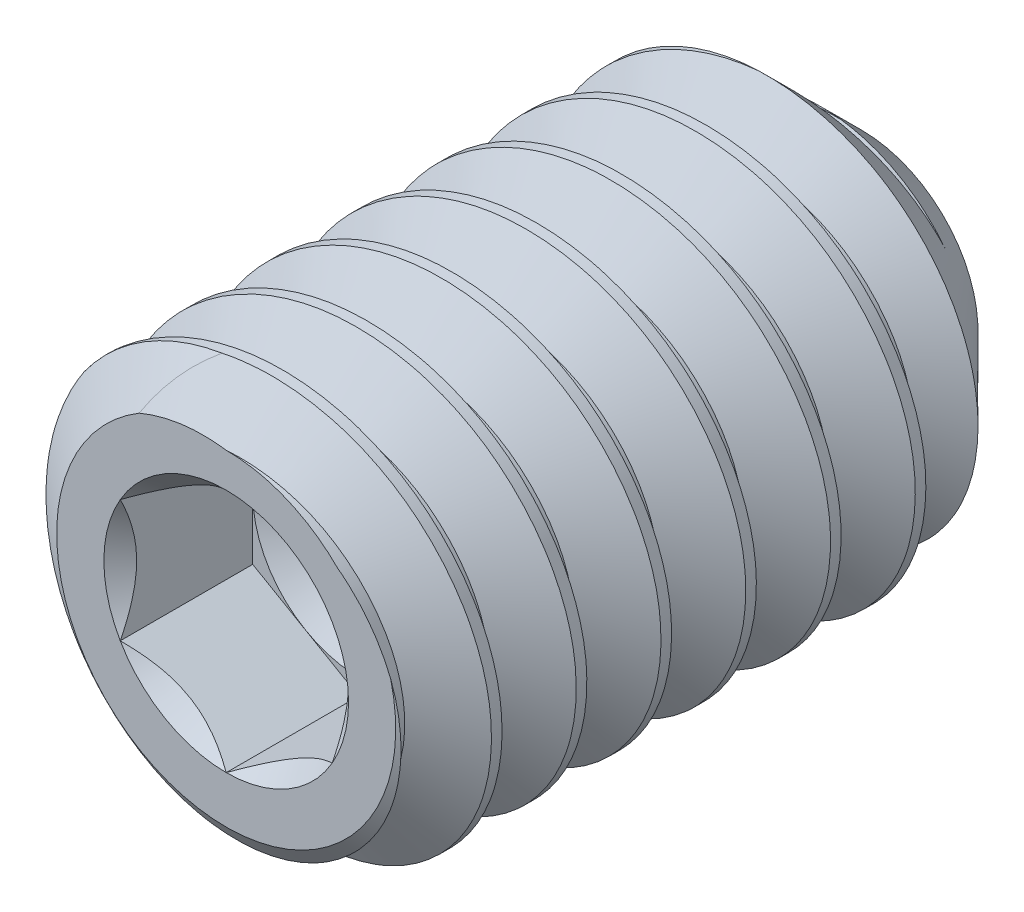
from build123d import *

# Parameters (mm, degrees)
CUT_SWEEP2_PITCH    = 1.27
CUT_EXTRUDE10_DEPTH = 1.984375


with BuildPart() as part:
    # Sketch22 → Revolve1 (revolve)
    with BuildSketch(Plane(origin=(0, 0, 0), x_dir=(0, 0, -1), z_dir=(1, 0, 0)), mode=Mode.PRIVATE) as revolve1_sk:
        Polygon((-4.239814779, 0), (-4.239814779, 2.54), (-3.795182992, 3.175), (3.849973798, 3.175), (5.285185221, 1.739788577), (4.239814779, 0), align=None)
    revolve(revolve1_sk.sketch.rotate(Axis((0, 0, -4.239814779), (0, 0, -1)), 180), axis=Axis((0, 0, -4.239814779), (0, 0, -1)))

    # Cut-Sweep2: the profile of Sketch28 profile screwed along a right-hand helix of 8.5 turns, 8 arcs to a turn; built about Z, then put on its axis
    cut_sweep2_z = Axis((0, 0, 0), (0, 0, 1))
    cut_sweep2_corners = [(3.1753, 0, 0.000173205), (3.1753, 0, -1.111423205), (2.350110803, 0, -0.635), (2.350110803, 0, -0.47625)]
    with BuildLine(mode=Mode.PRIVATE) as cut_sweep2_profile:
        Line(cut_sweep2_corners[0], cut_sweep2_corners[1])
        Line(cut_sweep2_corners[1], cut_sweep2_corners[2])
        Line(cut_sweep2_corners[2], cut_sweep2_corners[3])
        Line(cut_sweep2_corners[3], cut_sweep2_corners[0])
    cut_sweep2_cap = Face(cut_sweep2_profile.wire())
    cut_sweep2_turn_angles = [0, 22.5, 45, 67.5, 90, 112.5, 135, 157.5, 180, 202.5, 225, 247.5, 270, 292.5, 315, 337.5, 360]
    cut_sweep2_turn_weights = [1, 0.9238795325112867, 1, 0.9238795325112867, 1, 0.9238795325112867, 1, 0.9238795325112867, 1, 0.9238795325112867, 1, 0.9238795325112867, 1, 0.9238795325112867, 1, 0.9238795325112867, 1]
    cut_sweep2_turn_rails = [Edge.make_bspline([Vector(p[0], p[1], 0).rotate(cut_sweep2_z, cut_sweep2_turn_angles[k]) / cut_sweep2_turn_weights[k] + Vector(0, 0, p[2] + CUT_SWEEP2_PITCH * cut_sweep2_turn_angles[k] / 360) for k in range(17)], [0, 0, 0, 1, 1, 2, 2, 3, 3, 4, 4, 5, 5, 6, 6, 7, 7, 8, 8, 8], 2, cut_sweep2_turn_weights) for p in cut_sweep2_corners]
    cut_sweep2_turn_sides = [Face.make_surface_from_curves(cut_sweep2_turn_rails[p[0]], cut_sweep2_turn_rails[p[1]]) for p in [(0, 1), (1, 2), (2, 3), (3, 0)]]
    cut_sweep2_last_angles = [2880, 2902.5, 2925, 2947.5, 2970, 2992.5, 3015, 3037.5, 3060]
    cut_sweep2_last_weights = [1, 0.9238795325112867, 1, 0.9238795325112867, 1, 0.9238795325112867, 1, 0.9238795325112867, 1]
    cut_sweep2_last_rails = [Edge.make_bspline([Vector(p[0], p[1], 0).rotate(cut_sweep2_z, cut_sweep2_last_angles[k]) / cut_sweep2_last_weights[k] + Vector(0, 0, p[2] + CUT_SWEEP2_PITCH * cut_sweep2_last_angles[k] / 360) for k in range(9)], [0, 0, 0, 1, 1, 2, 2, 3, 3, 4, 4, 4], 2, cut_sweep2_last_weights) for p in cut_sweep2_corners]
    cut_sweep2_last_sides = [Face.make_surface_from_curves(cut_sweep2_last_rails[p[0]], cut_sweep2_last_rails[p[1]]) for p in [(0, 1), (1, 2), (2, 3), (3, 0)]]
    cut_sweep2 = Plane(origin=(0, 0, -5.285185221), x_dir=(0, 1, 0), z_dir=(0, 0, 1)) * Solid(Shell([*[p.moved(Location((0, 0, CUT_SWEEP2_PITCH * i))) for i in range(8) for p in cut_sweep2_turn_sides], *cut_sweep2_last_sides, cut_sweep2_cap, cut_sweep2_cap.rotate(cut_sweep2_z, 3060).moved(Location((0, 0, CUT_SWEEP2_PITCH * 3060 / 360)))]))
    add(cut_sweep2, mode=Mode.SUBTRACT)

    # Sketch23 → Cut-Extrude10 (cut)
    with BuildSketch(Plane.XY.offset(4.239814779)):
        Polygon((0, 1.833087105), (-1.5875, 0.916543552), (-1.5875, -0.916543552), (0, -1.833087105), (1.5875, -0.916543552), (1.5875, 0.916543552), align=None)
    extrude(amount=-CUT_EXTRUDE10_DEPTH, mode=Mode.SUBTRACT)

    # Cut-Extrude11 cone 1 section (through the dimple's axis) → Cut-Extrude11 (revolve, cut)
    with BuildSketch(Plane(origin=(0, 0, 4.239814779), x_dir=(0, -1, 0), z_dir=(1, 0, 0))):
        Polygon((0, 0), (1.833087105, 0), (0, 1.833087105), align=None)
    revolve(axis=Axis((0, 0, 4.239814779), (0, 0, -1)), mode=Mode.SUBTRACT)

    # Cut-Extrude12 cone 1 section (through the dimple's axis) → Cut-Extrude12 (revolve, cut)
    with BuildSketch(Plane(origin=(0, 0, 2.255439779), x_dir=(0, -1, 0), z_dir=(1, 0, 0))):
        Polygon((0, 0), (1.5875, 0), (0, 0.916543552), align=None)
    revolve(axis=Axis((0, 0, 2.255439779), (0, 0, -1)), mode=Mode.SUBTRACT)


solid = part.part
